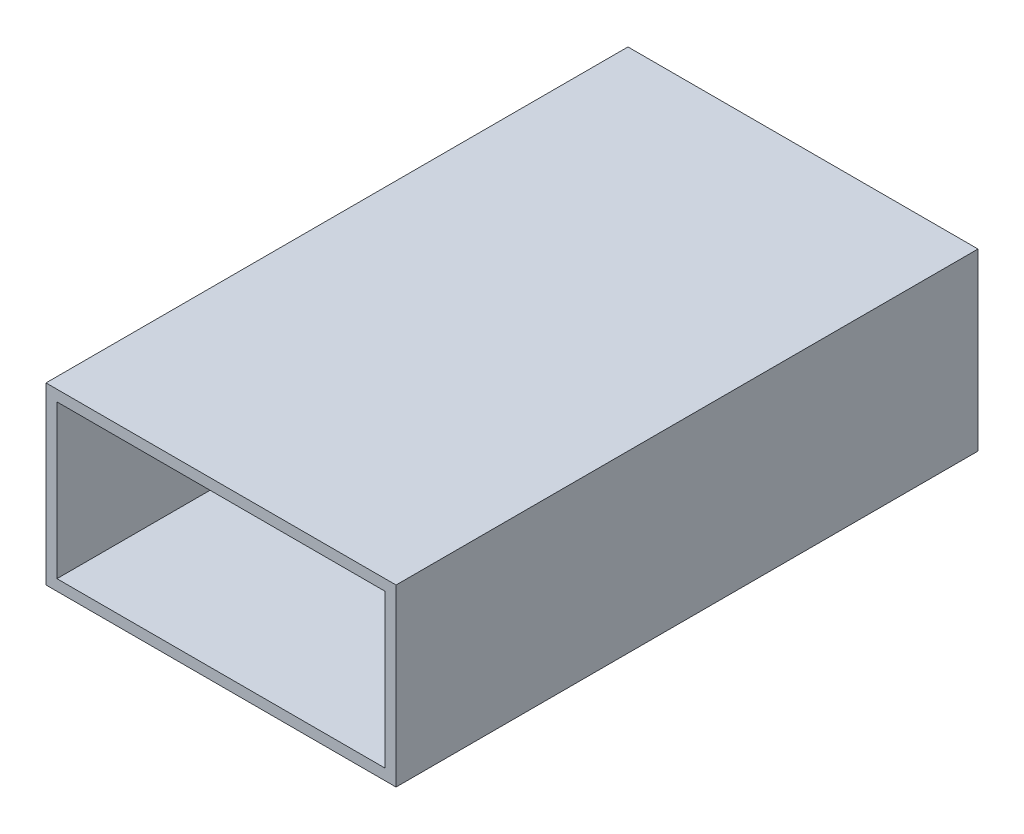
from build123d import *

# Parameters (mm, degrees)
SKETCH1_W           = 50.8
SKETCH1_H           = 25.4
SKETCH1_W_2         = 47.625
SKETCH1_H_2         = 22.225
BOSS_EXTRUDE1_DEPTH = 42.2275


with BuildPart() as part:
    # Sketch1 → Boss-Extrude1 (new, symmetric)
    with BuildSketch(Plane.XY):
        Rectangle(SKETCH1_W, SKETCH1_H)
        Rectangle(SKETCH1_W_2, SKETCH1_H_2, mode=Mode.SUBTRACT)
    extrude(amount=BOSS_EXTRUDE1_DEPTH, both=True)


solid = part.part
